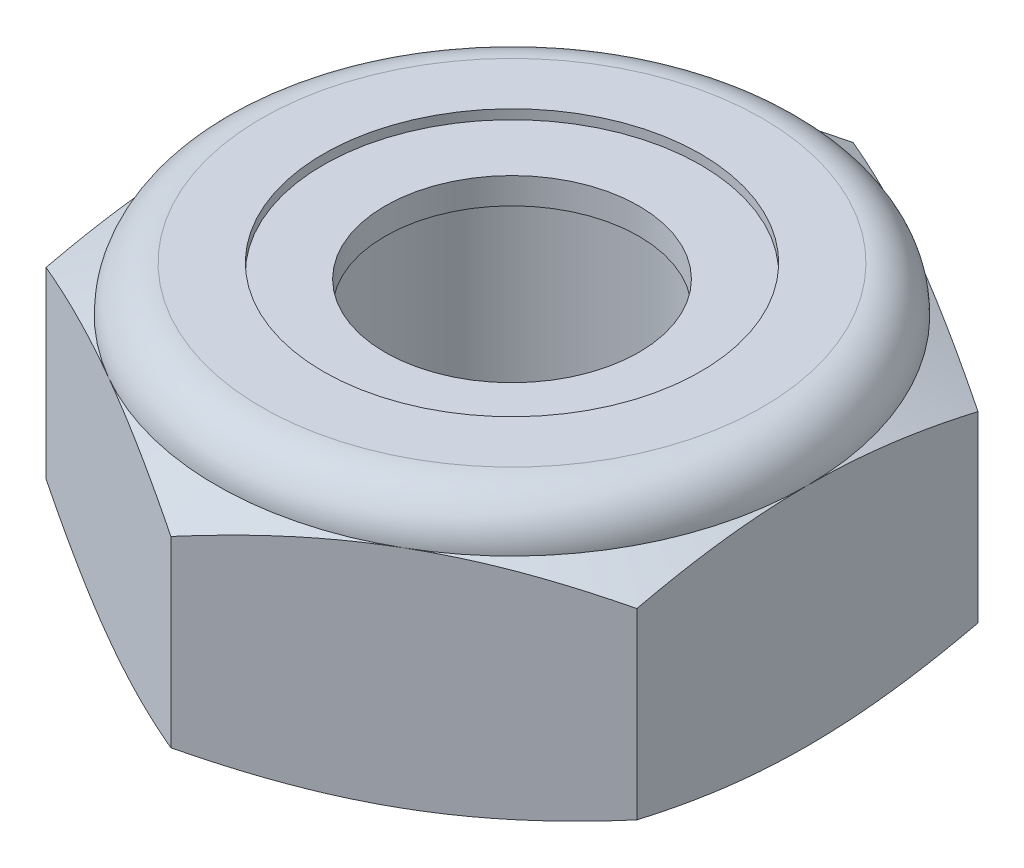
from build123d import *

# Parameters (mm, degrees)
EXTRUDE1_DEPTH = 4.365625
SKETCH2_W      = 2.413
SKETCH2_H      = 4.365625


with BuildPart() as part:
    # Sketch1 → Extrude1 (new body)
    with BuildSketch(Plane(origin=(0, 0, 0), x_dir=(1, 0, 0), z_dir=(0, 1, 0))):
        Polygon((0, 5.499261314), (-4.7625, 2.749630657), (-4.7625, -2.749630657), (0, -5.499261314), (4.7625, -2.749630657), (4.7625, 2.749630657), align=None)
    extrude(amount=EXTRUDE1_DEPTH)


with BuildPart() as body_2:
    # Sketch2 → Revolve1 (revolve)
    with BuildSketch(Plane(origin=(0, 0, 0), x_dir=(0, 0, -1), z_dir=(1, 0, 0))):
        with Locations((1.2065, 2.1828125)):
            Rectangle(SKETCH2_W, SKETCH2_H)
    revolve(axis=Axis((0, -2.413, 0), (0, 1, 0)))


with BuildPart() as part_1:
    add(part.part)

    # Combine1: cut body 2
    add(body_2.part, mode=Mode.SUBTRACT)

    # Sketch5 → Cut-Revolve3 (revolve, cut)
    with BuildSketch(Plane(origin=(0, 0, 0), x_dir=(0, 0, -1), z_dir=(1, 0, 0))):
        with BuildLine():
            Line((0, 0), (4.7625, 0))
            Line((4.7625, 0), (5.499261314, 0.343557443))
            Line((5.499261314, 0.343557443), (5.499261314, 3.29446339))
            Line((5.499261314, 3.29446339), (4.7625, 3.638020833))
            ThreePointArc((4.7625, 3.638020833), (4.549389674, 4.152514674), (4.034895833, 4.365625))
            Line((4.034895833, 4.365625), (4.034895833, 5.635625))
            Line((4.034895833, 5.635625), (6.769261314, 5.635625))
            Line((6.769261314, 5.635625), (6.769261314, -1.27))
            Line((6.769261314, -1.27), (0, -1.27))
            Line((0, -1.27), (0, 0))
        make_face()
    revolve(axis=Axis((0, 0, 0), (0, 1, 0)), mode=Mode.SUBTRACT)

    # Sketch6 → Cut-Revolve4 (revolve, cut)
    with BuildSketch(Plane(origin=(0, 0, 0), x_dir=(0, 0, -1), z_dir=(1, 0, 0))):
        with BuildLine():
            Line((0, 3.638020833), (4.6101, 3.638020833))
            ThreePointArc((4.6101, 3.638020833), (4.4416266, 4.0447516), (4.034895833, 4.213225))
            Line((4.034895833, 4.213225), (3.040160335, 4.213225))
            Line((3.040160335, 4.213225), (3.040160335, 5.635625))
            Line((3.040160335, 5.635625), (0, 5.635625))
            Line((0, 5.635625), (0, 3.638020833))
        make_face()
    revolve(axis=Axis((0, 5.635625, 0), (0, 1, 0)), mode=Mode.SUBTRACT)


with BuildPart() as body_2_2:
    # Sketch7 → Revolve2 (revolve)
    with BuildSketch(Plane(origin=(0, 0, 0), x_dir=(0, 0, -1), z_dir=(1, 0, 0))):
        with BuildLine():
            Line((2.045424837, 3.714220833), (4.528047654, 3.714220833))
            ThreePointArc((4.528047654, 3.714220833), (4.359688876, 4.016854092), (4.034895833, 4.137025))
            Line((4.034895833, 4.137025), (2.045424837, 4.137025))
            Line((2.045424837, 4.137025), (2.045424837, 3.714220833))
        make_face()
    revolve(axis=Axis((0, 3.714220833, 0), (0, 1, 0)))


solid = Compound([part_1.part, body_2_2.part])
